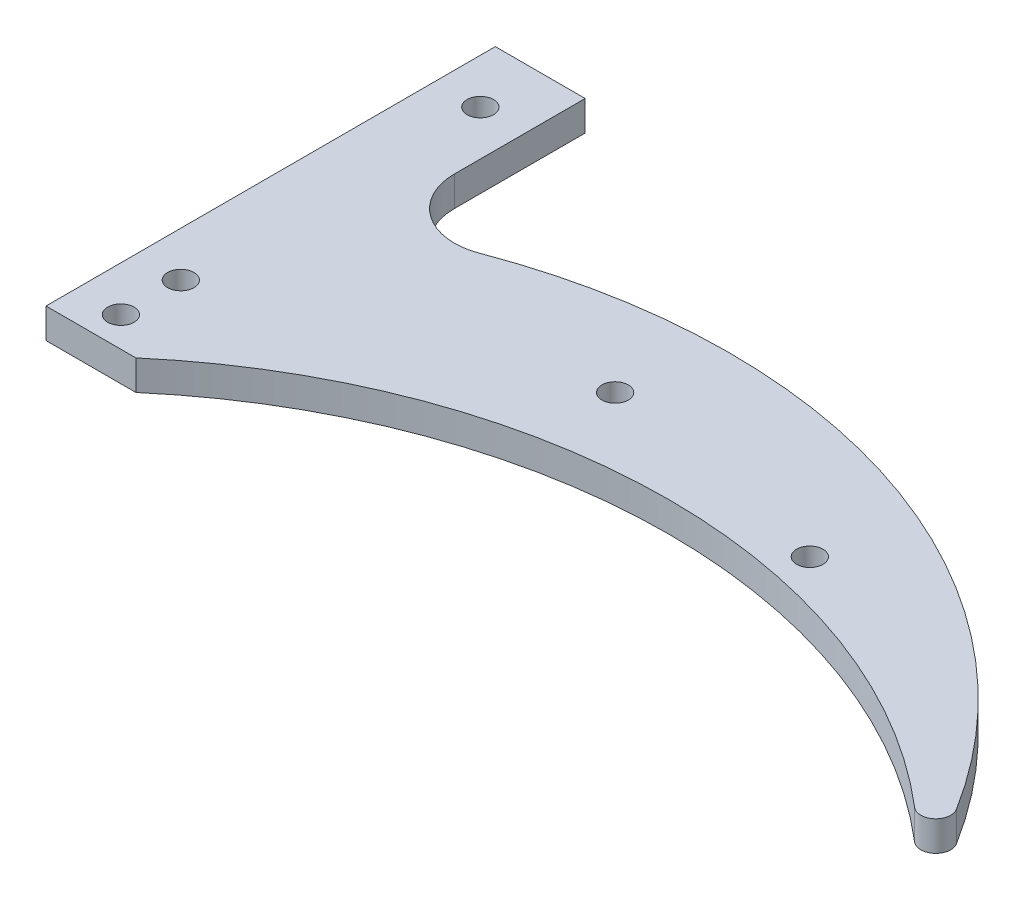
from build123d import *

# Parameters (mm, degrees)
SKETCH1_R           = 2.2
BOSS_EXTRUDE1_DEPTH = 5


with BuildPart() as part:
    # Sketch1 → Boss-Extrude1 (new body)
    with BuildSketch(Plane(origin=(0, 0, 0), x_dir=(1, 0, 0), z_dir=(0, 1, 0))):
        with BuildLine():
            Line((0, 75), (0, 53.165914195))
            ThreePointArc((0, 53.165914195), (4.315565807, 44.938690611), (13.537441581, 43.812491984))
            ThreePointArc((13.537441581, 43.812491984), (80.9029452, 45.023033848), (133.74584981, 3.223465408))
            ThreePointArc((133.74584981, 3.223465408), (133.255689752, 0.004881448), (130, 0))
            ThreePointArc((130, 0), (65, 24.006579232), (0, 0))
            Line((0, 0), (-15, 0))
            Line((-15, 0), (-15, 75))
            Line((-15, 75), (0, 75))
        make_face()
        with Locations((-7.5, 5)):
            Circle(SKETCH1_R, mode=Mode.SUBTRACT)
        with Locations((-7.5, 15)):
            Circle(SKETCH1_R, mode=Mode.SUBTRACT)
        with Locations((-7.5, 65)):
            Circle(SKETCH1_R, mode=Mode.SUBTRACT)
        with Locations((85, 27.5)):
            Circle(SKETCH1_R, mode=Mode.SUBTRACT)
        with Locations((45, 35)):
            Circle(SKETCH1_R, mode=Mode.SUBTRACT)
    extrude(amount=BOSS_EXTRUDE1_DEPTH)


solid = part.part
